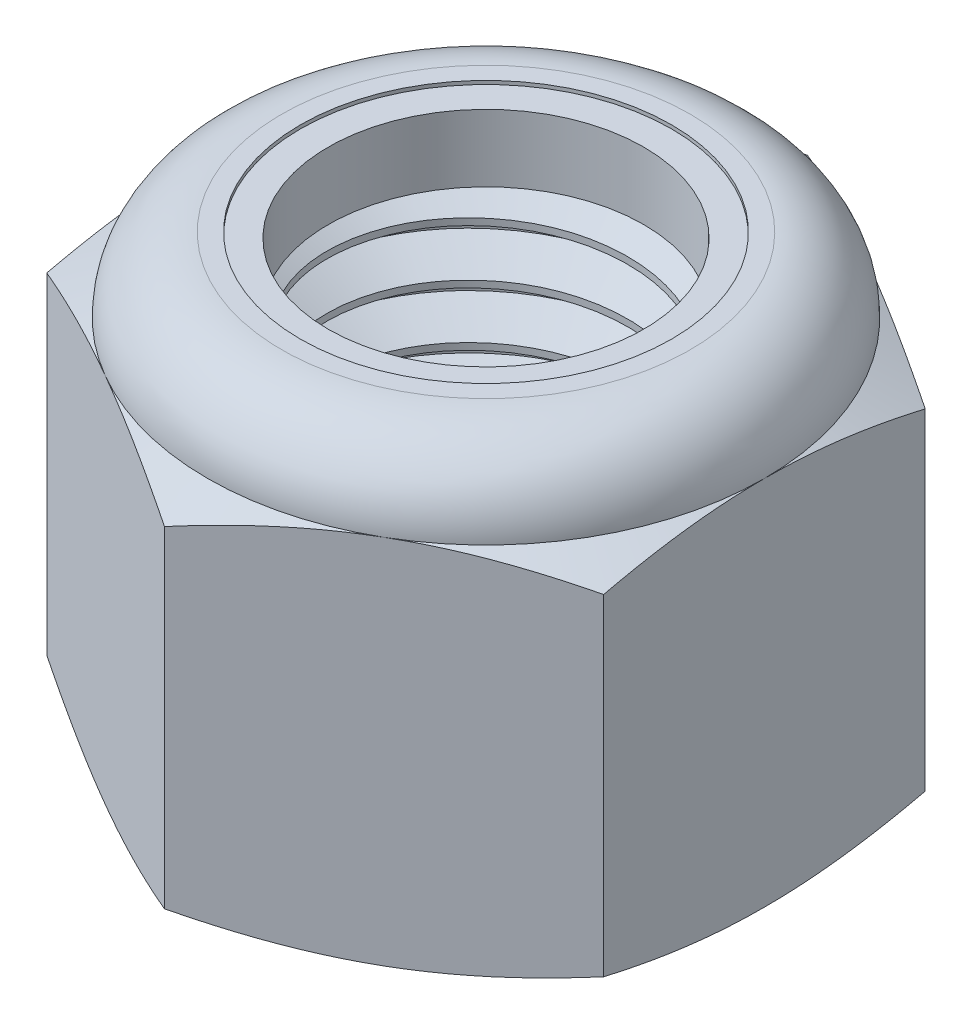
from build123d import *

# Parameters (mm, degrees)
SKETCH1_R        = 7.9375
EXTRUDE1_DEPTH   = 19.05
SKETCH2_W        = 7.9375
SKETCH2_H        = 15.875
CUT_SWEEP1_PITCH = 2.309090909
SKETCH12_W       = 8.73125
SKETCH12_H       = 15.875


with BuildPart() as part:
    # Sketch1 → Extrude1 (new body)
    with BuildSketch(Plane(origin=(0, 0, 0), x_dir=(1, 0, 0), z_dir=(0, 1, 0))):
        Polygon((0, 13.748153285), (-11.90625, 6.874076643), (-11.90625, -6.874076643), (0, -13.748153285), (11.90625, -6.874076643), (11.90625, 6.874076643), align=None)
        with Locations(Location((0, 0, 0), (0, 0, 90))):
            Circle(SKETCH1_R, mode=Mode.SUBTRACT)
    extrude(amount=EXTRUDE1_DEPTH)

    # Sketch5 → Cut-Revolve3 (revolve, cut)
    with BuildSketch(Plane(origin=(0, 0, 0), x_dir=(0, 0, -1), z_dir=(1, 0, 0))):
        with BuildLine():
            Line((0, 0), (11.90625, 0))
            Line((11.90625, 0), (13.748153285, 0.858893607))
            Line((13.748153285, 0.858893607), (13.748153285, 15.016106393))
            Line((13.748153285, 15.016106393), (11.90625, 15.875))
            ThreePointArc((11.90625, 15.875), (10.97631403, 18.12006403), (8.73125, 19.05))
            Line((8.73125, 19.05), (8.73125, 20.32))
            Line((8.73125, 20.32), (15.018153285, 20.32))
            Line((15.018153285, 20.32), (15.018153285, -1.27))
            Line((15.018153285, -1.27), (0, -1.27))
            Line((0, -1.27), (0, 0))
        make_face()
    revolve(axis=Axis((0, 0, 0), (0, 1, 0)), mode=Mode.SUBTRACT)

    # Sketch6 → Cut-Revolve4 (revolve, cut)
    with BuildSketch(Plane(origin=(0, 0, 0), x_dir=(0, 0, -1), z_dir=(1, 0, 0))):
        with BuildLine():
            Line((0, 15.875), (11.75385, 15.875))
            ThreePointArc((11.75385, 15.875), (10.868550957, 18.012300957), (8.73125, 18.8976))
            Line((8.73125, 18.8976), (4.365625, 18.8976))
            Line((4.365625, 18.8976), (4.365625, 20.32))
            Line((4.365625, 20.32), (0, 20.32))
            Line((0, 20.32), (0, 15.875))
        make_face()
    revolve(axis=Axis((0, 20.32, 0), (0, -1, 0)), mode=Mode.SUBTRACT)

    # Sketch4 → Cut-Revolve2 (revolve, cut)
    with BuildSketch(Plane(origin=(0, 0, 0), x_dir=(0, 0, -1), z_dir=(1, 0, 0))):
        Polygon((0, 15.875), (8.73125, 15.875), (0, 11.80355126), align=None)
        Polygon((0, 4.07144874), (8.73125, 0), (0, 0), align=None)
    revolve(axis=Axis((0, 0, 0), (0, 1, 0)), mode=Mode.SUBTRACT)

    # Sketch12 → Revolve4 (revolve)
    with BuildSketch(Plane(origin=(0, 0, 0), x_dir=(0, 0, -1), z_dir=(1, 0, 0)), mode=Mode.PRIVATE) as revolve4_sk:
        with Locations((4.365625, 7.9375)):
            Rectangle(SKETCH12_W, SKETCH12_H)
    revolve(revolve4_sk.sketch.rotate(Axis((0, 0, 0), (0, 1, 0)), 180), axis=Axis((0, 0, 0), (0, 1, 0)))


with BuildPart() as body_2:
    # Sketch7 → Revolve2 (revolve)
    with BuildSketch(Plane(origin=(0, 0, 0), x_dir=(0, 0, -1), z_dir=(1, 0, 0))):
        with BuildLine():
            Line((6.746875, 15.9512), (11.67666449, 15.9512))
            ThreePointArc((11.67666449, 15.9512), (10.787552176, 17.985188219), (8.73125, 18.8214))
            Line((8.73125, 18.8214), (6.746875, 18.8214))
            Line((6.746875, 18.8214), (6.746875, 15.9512))
        make_face()
    revolve(axis=Axis((0, 15.9512, 0), (0, 1, 0)))


with BuildPart() as body_3:
    # Sketch2 → Revolve1 (revolve)
    with BuildSketch(Plane(origin=(0, 0, 0), x_dir=(0, 0, -1), z_dir=(1, 0, 0)), mode=Mode.PRIVATE) as revolve1_sk:
        with Locations((3.96875, 7.9375)):
            Rectangle(SKETCH2_W, SKETCH2_H)
    revolve(revolve1_sk.sketch.rotate(Axis((0, -7.9375, 0), (0, 1, 0)), 180), axis=Axis((0, -7.9375, 0), (0, 1, 0)))

    # Cut-Sweep1: the profile of Sketch9 screwed along a right-hand helix of 9.25 turns, 10 arcs to a turn; built about Z, then put on its axis
    cut_sweep1_z = Axis((0, 0, 0), (0, 0, 1))
    cut_sweep1_corners = [(8.187466423, 0, 0.144318182), (8.062483212, 0, -2.092613636), (6.43770146, 0, -1.154545455), (6.43770146, 0, -0.865909091)]
    with BuildLine(mode=Mode.PRIVATE) as cut_sweep1_profile:
        Line(cut_sweep1_corners[0], cut_sweep1_corners[1])
        Line(cut_sweep1_corners[1], cut_sweep1_corners[2])
        Line(cut_sweep1_corners[2], cut_sweep1_corners[3])
        Line(cut_sweep1_corners[3], cut_sweep1_corners[0])
    cut_sweep1_cap = Face(cut_sweep1_profile.wire())
    cut_sweep1_turn_angles = [0, 18, 36, 54, 72, 90, 108, 126, 144, 162, 180, 198, 216, 234, 252, 270, 288, 306, 324, 342, 360]
    cut_sweep1_turn_weights = [1, 0.9510565162951535, 1, 0.9510565162951535, 1, 0.9510565162951535, 1, 0.9510565162951535, 1, 0.9510565162951535, 1, 0.9510565162951535, 1, 0.9510565162951535, 1, 0.9510565162951535, 1, 0.9510565162951535, 1, 0.9510565162951535, 1]
    cut_sweep1_turn_rails = [Edge.make_bspline([Vector(p[0], p[1], 0).rotate(cut_sweep1_z, cut_sweep1_turn_angles[k]) / cut_sweep1_turn_weights[k] + Vector(0, 0, p[2] + CUT_SWEEP1_PITCH * cut_sweep1_turn_angles[k] / 360) for k in range(21)], [0, 0, 0, 1, 1, 2, 2, 3, 3, 4, 4, 5, 5, 6, 6, 7, 7, 8, 8, 9, 9, 10, 10, 10], 2, cut_sweep1_turn_weights) for p in cut_sweep1_corners]
    cut_sweep1_turn_sides = [Face.make_surface_from_curves(cut_sweep1_turn_rails[p[0]], cut_sweep1_turn_rails[p[1]]) for p in [(0, 1), (1, 2), (2, 3), (3, 0)]]
    cut_sweep1_last_angles = [3240, 3258, 3276, 3294, 3312, 3321, 3330]
    cut_sweep1_last_weights = [1, 0.9510565162951535, 1, 0.9510565162951535, 1, 0.9876883405951117, 1]
    cut_sweep1_last_rails = [Edge.make_bspline([Vector(p[0], p[1], 0).rotate(cut_sweep1_z, cut_sweep1_last_angles[k]) / cut_sweep1_last_weights[k] + Vector(0, 0, p[2] + CUT_SWEEP1_PITCH * cut_sweep1_last_angles[k] / 360) for k in range(7)], [0, 0, 0, 1, 1, 2, 2, 3, 3, 3], 2, cut_sweep1_last_weights) for p in cut_sweep1_corners]
    cut_sweep1_last_sides = [Face.make_surface_from_curves(cut_sweep1_last_rails[p[0]], cut_sweep1_last_rails[p[1]]) for p in [(0, 1), (1, 2), (2, 3), (3, 0)]]
    cut_sweep1 = Plane(origin=(0, 15.875, 0), x_dir=(0, 0, -1), z_dir=(0, -1, 0)) * Solid(Shell([*[p.moved(Location((0, 0, CUT_SWEEP1_PITCH * i))) for i in range(9) for p in cut_sweep1_turn_sides], *cut_sweep1_last_sides, cut_sweep1_cap, cut_sweep1_cap.rotate(cut_sweep1_z, 3330).moved(Location((0, 0, CUT_SWEEP1_PITCH * 3330 / 360)))]))
    add(cut_sweep1, mode=Mode.SUBTRACT)

    # Sketch11 → Revolve3 (revolve)
    with BuildSketch(Plane(origin=(0, 0, 0), x_dir=(0, 0, -1), z_dir=(1, 0, 0)), mode=Mode.PRIVATE) as revolve3_sk:
        Polygon((0, 0), (8.73125, 0), (0, 4.07144874), align=None)
    revolve(revolve3_sk.sketch.rotate(Axis((0, 19.05, 0), (0, -1, 0)), 328.355485486), axis=Axis((0, 19.05, 0), (0, -1, 0)))


with BuildPart() as part_1:
    add(part.part)

    # Combine1: cut body 3
    add(body_3.part, mode=Mode.SUBTRACT)


solid = Compound([body_2.part, part_1.part])
